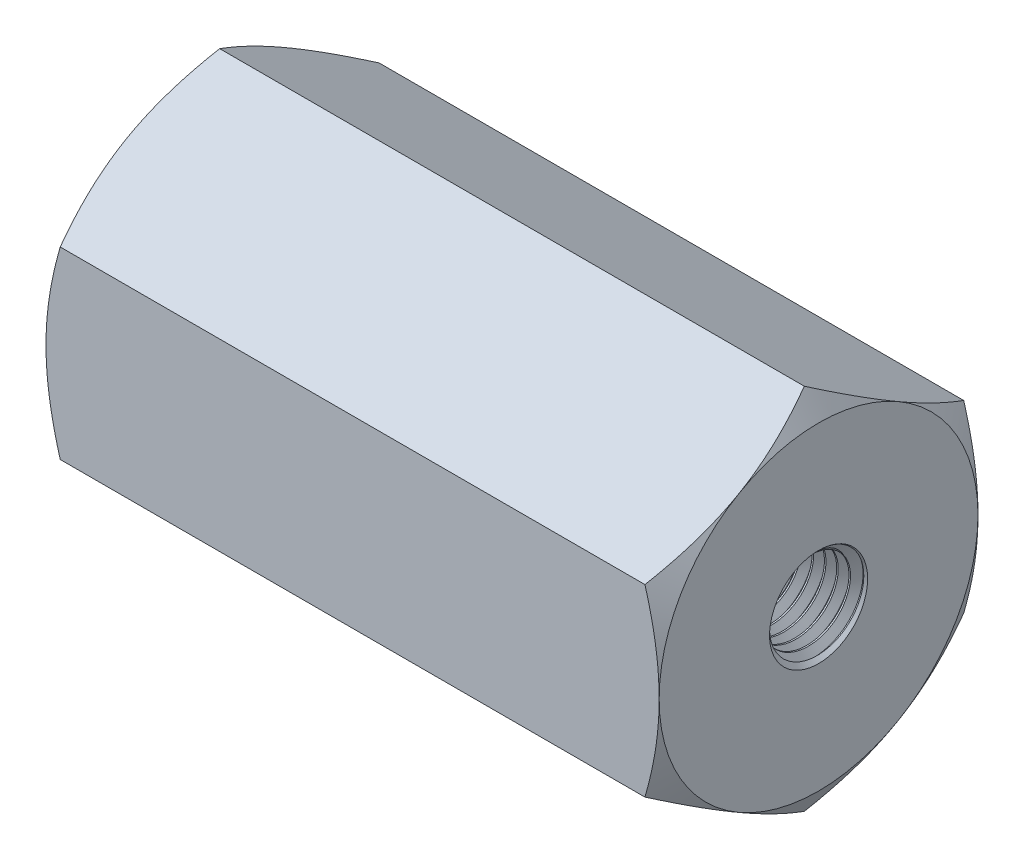
from build123d import *

# Parameters (mm, degrees)
BOSS_EXTRUDE1_DEPTH     = 12.5
SKETCH2_OUTSIDE_W       = 118.032
SKETCH2_OUTSIDE_H       = 120.044
SKETCH2_OUTSIDE_R       = 6.5
CUT_EXTRUDE1_DEPTH      = 27.899504332
CUT_EXTRUDE1_DRAFT      = -60
MIRROR1_COPY_1_SKETCH_W = 118.032
MIRROR1_COPY_1_SKETCH_H = 120.044
MIRROR1_COPY_1_SKETCH_R = 6.5
MIRROR1_COPY_1_DEPTH    = 27.899504332
MIRROR1_COPY_1_DRAFT    = -60
SKETCH3_R               = 2
CUT_EXTRUDE2_DEPTH      = 4
SKETCH4_R               = 2.5
CUT_EXTRUDE3_DEPTH      = 4
SKETCH5_R               = 2.5
BOSS_EXTRUDE2_DEPTH     = 4
SKETCH6_R               = 2
BOSS_EXTRUDE3_DEPTH     = 4
CUT_SWEEP1_PITCH        = 0.5
CUT_SWEEP2_PITCH        = 0.5
BOSS_EXTRUDE6_DEPTH     = 25


with BuildPart() as part:
    # Sketch1 → Boss-Extrude1 (new, symmetric)
    with BuildSketch(Plane(origin=(0, 0, 0), x_dir=(0, 0, -1), z_dir=(1, 0, 0))):
        Polygon((-6.5, 3.75277675), (-6.5, -3.75277675), (0, -7.505553499), (6.5, -3.75277675), (6.5, 3.75277675), (0, 7.505553499), align=None)
    extrude(amount=BOSS_EXTRUDE1_DEPTH, both=True)


with BuildPart() as cut_extrude1_tool:
    # Sketch2 outside → Cut-Extrude1 (with draft: the straight prism first)
    with BuildSketch(Plane(origin=(12.5, 0, 0), x_dir=(0, 0, -1), z_dir=(1, 0, 0))):
        Rectangle(SKETCH2_OUTSIDE_W, SKETCH2_OUTSIDE_H)
        Circle(SKETCH2_OUTSIDE_R, mode=Mode.SUBTRACT)
    extrude(amount=-CUT_EXTRUDE1_DEPTH)
    # Cut-Extrude1: the draft: its side faces are tilted about the plane it starts from
    cut_extrude1_sides = [cut_extrude1_tool.faces().sort_by_distance(p)[0] for p in [
        (-1.449752166, -60.022, 0),
        (-1.449752166, 0, -59.016),
        (-1.449752166, 60.022, 0),
        (-1.449752166, 0, 59.016),
        (-1.449752166, 0, 6.5),
    ]]
    draft(cut_extrude1_sides, Plane(origin=(12.5, 0, 0), x_dir=(0, 0, -1), z_dir=(1, 0, 0)), CUT_EXTRUDE1_DRAFT)


with BuildPart() as part_1:
    add(part.part)

    # Cut-Extrude1: cut by cut_extrude1_tool
    add(cut_extrude1_tool.part, mode=Mode.SUBTRACT)


with BuildPart() as mirror1_copy_1_tool:
    # Mirror1 copy 1 sketch → Mirror1 copy 1 (with draft: the straight prism first)
    with BuildSketch(Plane(origin=(-12.5, 0, 0), x_dir=(0, 0, -1), z_dir=(-1, 0, 0))):
        Rectangle(MIRROR1_COPY_1_SKETCH_W, MIRROR1_COPY_1_SKETCH_H)
        Circle(MIRROR1_COPY_1_SKETCH_R, mode=Mode.SUBTRACT)
    extrude(amount=-MIRROR1_COPY_1_DEPTH)
    # Mirror1 copy 1: the draft: its side faces are tilted about the plane it starts from
    mirror1_copy_1_sides = [mirror1_copy_1_tool.faces().sort_by_distance(p)[0] for p in [
        (1.449752166, -60.022, 0),
        (1.449752166, 0, -59.016),
        (1.449752166, 60.022, 0),
        (1.449752166, 0, 59.016),
        (1.449752166, 0, 6.5),
    ]]
    draft(mirror1_copy_1_sides, Plane(origin=(-12.5, 0, 0), x_dir=(0, 0, -1), z_dir=(-1, 0, 0)), MIRROR1_COPY_1_DRAFT)


with BuildPart() as part_2:
    add(part_1.part)

    # Mirror1 copy 1: cut by mirror1_copy_1_tool
    add(mirror1_copy_1_tool.part, mode=Mode.SUBTRACT)

    # Sketch3 → Cut-Extrude2 (cut)
    with BuildSketch(Plane(origin=(12.5, 0, 0), x_dir=(0, 0, -1), z_dir=(1, 0, 0))):
        Circle(SKETCH3_R)
    extrude(amount=-CUT_EXTRUDE2_DEPTH, mode=Mode.SUBTRACT)

    # Sketch4 → Cut-Extrude3 (cut)
    with BuildSketch(Plane.ZY.offset(12.5)):
        Circle(SKETCH4_R)
    extrude(amount=-CUT_EXTRUDE3_DEPTH, mode=Mode.SUBTRACT)

    # Sketch14 → Boss-Extrude6 (add)
    with BuildSketch(Plane.ZY.offset(12.5)):
        with BuildLine():
            ThreePointArc((-3.2, 5.542562584), (-5.542562584, 3.2), (-6.4, 0))
            ThreePointArc((-6.4, 0), (-5.542562584, -3.2), (-3.2, -5.542562584))
            ThreePointArc((-3.2, -5.542562584), (0, -6.4), (3.2, -5.542562584))
            ThreePointArc((3.2, -5.542562584), (5.542562584, -3.2), (6.4, 0))
            ThreePointArc((6.4, 0), (5.542562584, 3.2), (3.2, 5.542562584))
            ThreePointArc((3.2, 5.542562584), (0, 6.4), (-3.2, 5.542562584))
        make_face()
    extrude(amount=-BOSS_EXTRUDE6_DEPTH)


with BuildPart() as body_2:
    # Sketch5 → Boss-Extrude2 (new body)
    with BuildSketch(Plane.ZY.offset(12.5)):
        Circle(SKETCH5_R)
    extrude(amount=-BOSS_EXTRUDE2_DEPTH)

    # Cut-Sweep2: the profile of Sketch12 profile screwed along a right-hand helix of 9 turns, 6 arcs to a turn; built about Z, then put on its axis
    cut_sweep2_z = Axis((0, 0, 0), (0, 0, 1))
    cut_sweep2_corners = [(2.5003, 0, 0.000173205), (2.5003, 0, -0.437673205), (2.175240474, 0, -0.25), (2.175240474, 0, -0.1875)]
    with BuildLine(mode=Mode.PRIVATE) as cut_sweep2_profile:
        Line(cut_sweep2_corners[0], cut_sweep2_corners[1])
        Line(cut_sweep2_corners[1], cut_sweep2_corners[2])
        Line(cut_sweep2_corners[2], cut_sweep2_corners[3])
        Line(cut_sweep2_corners[3], cut_sweep2_corners[0])
    cut_sweep2_cap = Face(cut_sweep2_profile.wire())
    cut_sweep2_turn_angles = [0, 30, 60, 90, 120, 150, 180, 210, 240, 270, 300, 330, 360]
    cut_sweep2_turn_weights = [1, 0.8660254037844387, 1, 0.8660254037844387, 1, 0.8660254037844387, 1, 0.8660254037844387, 1, 0.8660254037844387, 1, 0.8660254037844387, 1]
    cut_sweep2_turn_rails = [Edge.make_bspline([Vector(p[0], p[1], 0).rotate(cut_sweep2_z, cut_sweep2_turn_angles[k]) / cut_sweep2_turn_weights[k] + Vector(0, 0, p[2] + CUT_SWEEP2_PITCH * cut_sweep2_turn_angles[k] / 360) for k in range(13)], [0, 0, 0, 1, 1, 2, 2, 3, 3, 4, 4, 5, 5, 6, 6, 6], 2, cut_sweep2_turn_weights) for p in cut_sweep2_corners]
    cut_sweep2_turn_sides = [Face.make_surface_from_curves(cut_sweep2_turn_rails[p[0]], cut_sweep2_turn_rails[p[1]]) for p in [(0, 1), (1, 2), (2, 3), (3, 0)]]
    cut_sweep2 = Plane(origin=(-12.5, 0, 0), x_dir=(0, 1, 0), z_dir=(1, 0, 0)) * Solid(Shell([*[p.moved(Location((0, 0, CUT_SWEEP2_PITCH * i))) for i in range(9) for p in cut_sweep2_turn_sides], cut_sweep2_cap, cut_sweep2_cap.rotate(cut_sweep2_z, 3240).moved(Location((0, 0, CUT_SWEEP2_PITCH * 3240 / 360)))]))
    add(cut_sweep2, mode=Mode.SUBTRACT)

    # Boss-Extrude5 cone 1 section (through the dimple's axis) → Boss-Extrude5 (revolve)
    with BuildSketch(Plane(origin=(-12.5, 0, 0), x_dir=(0, 0, 1), z_dir=(0, 1, 0))):
        Polygon((0, 0), (2.5, 0), (0, 2.5), align=None)
    revolve(axis=Axis((-12.5, 0, 0), (1, 0, 0)))


with BuildPart() as body_3:
    # Sketch6 → Boss-Extrude3 (new body)
    with BuildSketch(Plane(origin=(12.5, 0, 0), x_dir=(0, 0, -1), z_dir=(1, 0, 0))):
        Circle(SKETCH6_R)
    extrude(amount=-BOSS_EXTRUDE3_DEPTH)

    # Cut-Sweep1: the profile of Sketch9 profile screwed along a right-hand helix of 9 turns, 6 arcs to a turn; built about Z, then put on its axis
    cut_sweep1_z = Axis((0, 0, 0), (0, 0, 1))
    cut_sweep1_corners = [(2.0003, 0, 0.000173205), (2.0003, 0, -0.437673205), (1.675240474, 0, -0.25), (1.675240474, 0, -0.1875)]
    with BuildLine(mode=Mode.PRIVATE) as cut_sweep1_profile:
        Line(cut_sweep1_corners[0], cut_sweep1_corners[1])
        Line(cut_sweep1_corners[1], cut_sweep1_corners[2])
        Line(cut_sweep1_corners[2], cut_sweep1_corners[3])
        Line(cut_sweep1_corners[3], cut_sweep1_corners[0])
    cut_sweep1_cap = Face(cut_sweep1_profile.wire())
    cut_sweep1_turn_angles = [0, 30, 60, 90, 120, 150, 180, 210, 240, 270, 300, 330, 360]
    cut_sweep1_turn_weights = [1, 0.8660254037844387, 1, 0.8660254037844387, 1, 0.8660254037844387, 1, 0.8660254037844387, 1, 0.8660254037844387, 1, 0.8660254037844387, 1]
    cut_sweep1_turn_rails = [Edge.make_bspline([Vector(p[0], p[1], 0).rotate(cut_sweep1_z, cut_sweep1_turn_angles[k]) / cut_sweep1_turn_weights[k] + Vector(0, 0, p[2] + CUT_SWEEP1_PITCH * cut_sweep1_turn_angles[k] / 360) for k in range(13)], [0, 0, 0, 1, 1, 2, 2, 3, 3, 4, 4, 5, 5, 6, 6, 6], 2, cut_sweep1_turn_weights) for p in cut_sweep1_corners]
    cut_sweep1_turn_sides = [Face.make_surface_from_curves(cut_sweep1_turn_rails[p[0]], cut_sweep1_turn_rails[p[1]]) for p in [(0, 1), (1, 2), (2, 3), (3, 0)]]
    cut_sweep1 = Plane(origin=(12.5, 0, 0), x_dir=(0, 1, 0), z_dir=(-1, 0, 0)) * Solid(Shell([*[p.moved(Location((0, 0, CUT_SWEEP1_PITCH * i))) for i in range(9) for p in cut_sweep1_turn_sides], cut_sweep1_cap, cut_sweep1_cap.rotate(cut_sweep1_z, 3240).moved(Location((0, 0, CUT_SWEEP1_PITCH * 3240 / 360)))]))
    add(cut_sweep1, mode=Mode.SUBTRACT)

    # Boss-Extrude4 cone 1 section (through the dimple's axis) → Boss-Extrude4 (revolve)
    with BuildSketch(Plane(origin=(12.5, 0, 0), x_dir=(0, 0, -1), z_dir=(0, 1, 0))):
        Polygon((0, 0), (2, 0), (0, 2), align=None)
    revolve(axis=Axis((12.5, 0, 0), (-1, 0, 0)))


with BuildPart() as part_3:
    add(part_2.part)

    # Combine1: cut body 3, body 2
    add(body_3.part, mode=Mode.SUBTRACT)
    add(body_2.part, mode=Mode.SUBTRACT)


solid = part_3.part
